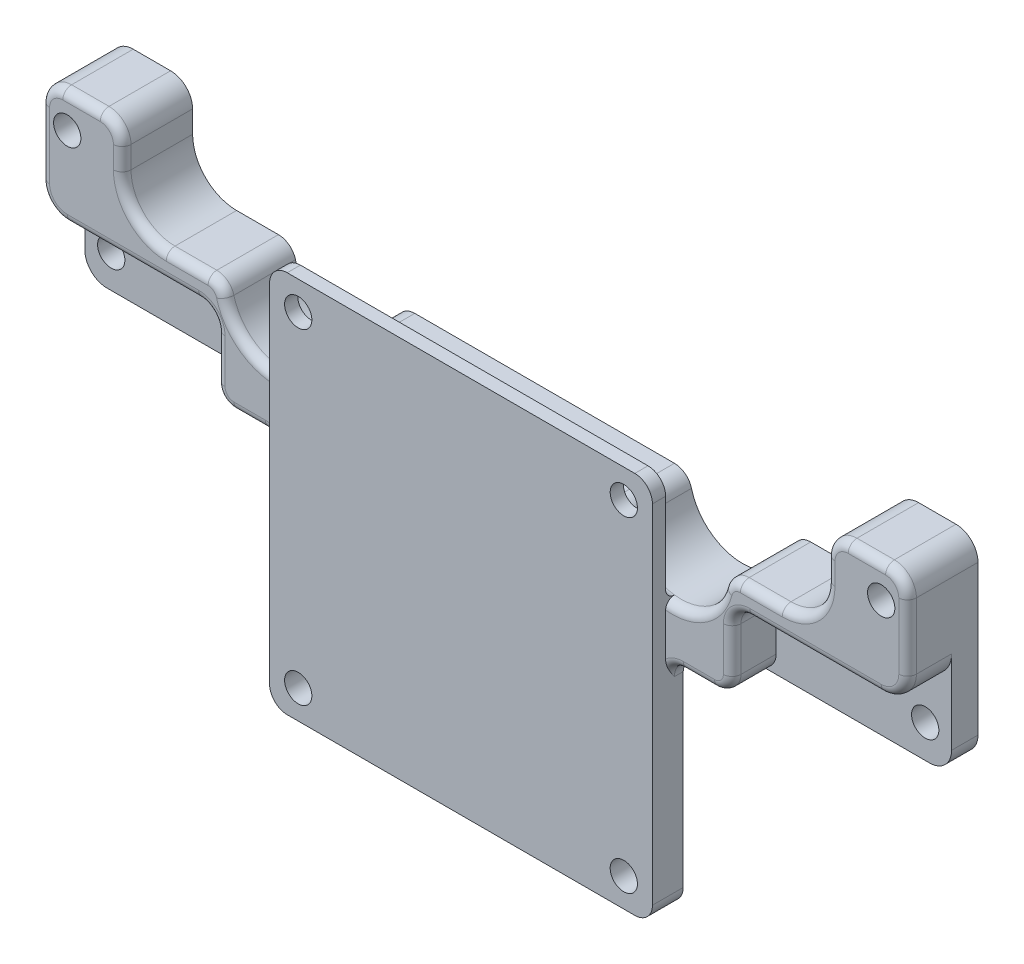
from build123d import *

# Parameters (mm, degrees)
SKETCH2_R               = 2
BOSS_EXTRUDE1_DEPTH     = 8
FILLET1_R               = 2.5
FILLET2_R               = 2.5
FILLET3_R               = 5
SKETCH4_R               = 6
CUT_EXTRUDE1_DEPTH      = 3
FILLET4_R               = 2
SKETCH6_W               = 43.5
SKETCH6_H               = 43.5
BOSS_EXTRUDE2_DEPTH     = 1.5
CUT_EXTRUDE2_DEPTH      = 62.356539994
SKETCH7_R               = 1.55
CUT_EXTRUDE3_DEPTH      = 62.885983874
SKETCH9_W               = 43.5
SKETCH9_H               = 25.25
SKETCH9_R               = 1.55
BOSS_EXTRUDE3_DEPTH     = 2
FILLET5_R               = 2
SKETCH11_W              = 24
SKETCH11_H              = 12.133982922
CUT_EXTRUDE4_DEPTH      = 5
FILLET6_R               = 2
FILLET7_R               = 3
FILLET8_R               = 1
FILLET9_R               = 2
FILLET11_R              = 1
CUT_EXTRUDE5_DEPTH      = 62.885983932
CUT_EXTRUDE5_DEPTH_BACK = 62.885983932
BOSS_EXTRUDE4_START     = -8
SKETCH14_R              = 2
SKETCH14_R_2            = 1.55
BOSS_EXTRUDE4_DEPTH     = 8
SKETCH15_W              = 25.857004487
SKETCH15_H              = 16.199569076
SKETCH15_W_2            = 17.341846383
SKETCH15_H_2            = 17.1341596
CUT_EXTRUDE6_DEPTH      = 62.496951155


with BuildPart() as part:
    # Sketch2 → Boss-Extrude1 (new body)
    with BuildSketch(Plane.XY):
        Polygon((-49.25, -11), (49.25, -11), (49.25, 11), (40, 11), (40, 1), (-40, 1), (-40, 11), (-49.25, 11), align=None)
        with Locations((-46.25, 7.25)):
            Circle(SKETCH2_R, mode=Mode.SUBTRACT)
        with Locations((-46.25, -7.25)):
            Circle(SKETCH2_R, mode=Mode.SUBTRACT)
        with Locations(Location((46.25, 7.25, 0), (0, 0, 180))):
            Circle(SKETCH2_R, mode=Mode.SUBTRACT)
        with Locations(Location((46.25, -7.25, 0), (0, 0, 180))):
            Circle(SKETCH2_R, mode=Mode.SUBTRACT)
    extrude(amount=BOSS_EXTRUDE1_DEPTH)

    # Fillet1
    fillet1_edges = [part.edges().sort_by_distance(p)[0] for p in [
        (-49.25, -11, 4),
        (-49.25, 11, 4),
        (49.25, 11, 4),
        (49.25, -11, 4),
    ]]
    fillet(fillet1_edges, radius=FILLET1_R)

    # Fillet2
    fillet2_edges = [part.edges().sort_by_distance(p)[0] for p in [
        (-40, 11, 4),
        (40, 11, 4),
    ]]
    fillet(fillet2_edges, radius=FILLET2_R)

    # Fillet3
    fillet3_edges = [part.edges().sort_by_distance(p)[0] for p in [
        (-40, 1, 4),
        (40, 1, 4),
    ]]
    fillet(fillet3_edges, radius=FILLET3_R)

    # Sketch4 → Cut-Extrude1 (cut)
    with BuildSketch(Plane.XY.offset(8)):
        with Locations((-22.5, 1)):
            Circle(SKETCH4_R)
        with Locations((22.5, 1)):
            Circle(SKETCH4_R)
    extrude(amount=-CUT_EXTRUDE1_DEPTH, mode=Mode.SUBTRACT)

    # Fillet4
    fillet4_edges = [part.edges().sort_by_distance(p)[0] for p in [
        (28.5, 1, 6.5),
        (-28.5, 1, 6.5),
        (-16.5, 1, 6.5),
        (16.5, 1, 6.5),
    ]]
    fillet(fillet4_edges, radius=FILLET4_R)

    # Sketch6 → Boss-Extrude2 (add)
    with BuildSketch(Plane.XY.offset(8)):
        with Locations((0, -14.5)):
            Rectangle(SKETCH6_W, SKETCH6_H)
    extrude(amount=BOSS_EXTRUDE2_DEPTH)

    # Sketch8 → Cut-Extrude2 (cut, through all)
    with BuildSketch(Plane.XY.offset(5)):
        with BuildLine():
            Line((30.245966692, 1), (14.754033308, 1))
            ThreePointArc((14.754033308, 1), (15.978778179, 0.58113883), (16.690524981, -0.5))
            ThreePointArc((16.690524981, -0.5), (22.5, -5), (28.309475019, -0.5))
            ThreePointArc((28.309475019, -0.5), (29.021221821, 0.58113883), (30.245966692, 1))
        make_face()
        with BuildLine():
            Line((-14.754033308, 1), (-30.245966692, 1))
            ThreePointArc((-30.245966692, 1), (-29.021221821, 0.58113883), (-28.309475019, -0.5))
            ThreePointArc((-28.309475019, -0.5), (-22.5, -5), (-16.690524981, -0.5))
            ThreePointArc((-16.690524981, -0.5), (-15.978778179, 0.58113883), (-14.754033308, 1))
        make_face()
    extrude(amount=-CUT_EXTRUDE2_DEPTH, mode=Mode.SUBTRACT)

    # Sketch7 → Cut-Extrude3 (cut, through all)
    with BuildSketch(Plane.XY.offset(9.5)):
        with Locations((-18.5, 4)):
            Circle(SKETCH7_R)
        with Locations((18.5, 4)):
            Circle(SKETCH7_R)
        with Locations((18.5, -33)):
            Circle(SKETCH7_R)
        with Locations((-18.5, -33)):
            Circle(SKETCH7_R)
    extrude(amount=-CUT_EXTRUDE3_DEPTH, mode=Mode.SUBTRACT)

    # Sketch9 → Boss-Extrude3 (add)
    with BuildSketch(Plane(origin=(0, 0, 8), x_dir=(-1, 0, 0), z_dir=(0, 0, -1))):
        with Locations((0, -23.625)):
            Rectangle(SKETCH9_W, SKETCH9_H)
        with Locations(Location((18.5, -33, 0), (0, 0, 180))):
            Circle(SKETCH9_R, mode=Mode.SUBTRACT)
        with Locations(Location((-18.5, -33, 0), (0, 0, 180))):
            Circle(SKETCH9_R, mode=Mode.SUBTRACT)
    extrude(amount=BOSS_EXTRUDE3_DEPTH)

    # Fillet5
    fillet5_edges = [part.edges().sort_by_distance(p)[0] for p in [
        (0, -11, 6),
        (-21.75, -11, 7),
        (21.75, -11, 7),
    ]]
    fillet(fillet5_edges, radius=FILLET5_R)

    # Sketch11 → Cut-Extrude4 (cut)
    with BuildSketch(Plane.XY.offset(8)):
        with Locations((41.314196824, -8.07245273)):
            Rectangle(SKETCH11_W, SKETCH11_H)
    extrude(amount=-CUT_EXTRUDE4_DEPTH, mode=Mode.SUBTRACT)

    # Fillet6
    fillet6_edges = [part.edges().sort_by_distance(p)[0] for p in [
        (29.314196824, -11, 5.5),
        (29.314196824, -2.005461269, 5.5),
    ]]
    fillet(fillet6_edges, radius=FILLET6_R)

    # Fillet7
    fillet7_edges = [part.edges().sort_by_distance(p)[0] for p in [
        (49.25, -2.005461269, 5.5),
    ]]
    fillet(fillet7_edges, radius=FILLET7_R)

    # Fillet8
    fillet8_edges = [part.edges().sort_by_distance(p)[0] for p in [
        (29.021221821, 0.58113883, 8),
        (25.869976488, -3.964197666, 8),
        (25.532098412, -11, 8),
        (22.335786438, -11.585786438, 8),
        (29.314196824, -6.502730634, 8),
        (28.728410386, -10.414213562, 8),
        (29.899983262, -2.591247706, 8),
        (49.25, 4.747269366, 8),
        (38.782098412, -2.005461269, 8),
        (48.371320344, -1.126781612, 8),
        (44.625, 11, 8),
        (48.517766953, 10.267766953, 8),
        (40.732233047, 10.267766953, 8),
        (32.622983346, 1, 8),
        (40, 7.25, 8),
        (38.535533906, 2.464466094, 8),
    ]]
    fillet(fillet8_edges, radius=FILLET8_R - 0.0001)  # a hair under: the kernel refuses the full size

    # Fillet9
    fillet9_edges = [part.edges().sort_by_distance(p)[0] for p in [
        (21.75, -36.25, 7.75),
        (21.75, 7.25, 8.75),
    ]]
    fillet(fillet9_edges, radius=FILLET9_R)

    # Fillet11
    fillet11_edges = [part.edges().sort_by_distance(p)[0] for p in [
        (18.5359304, -3.50401512, 8),
        (15.978778179, 0.58113883, 8),
        (-18.5359304, -3.50401512, 8),
        (-15.978778179, 0.58113883, 8),
        (0, 1, 8),
    ]]
    fillet(fillet11_edges, radius=FILLET11_R - 0.0001)  # a hair under: the kernel refuses the full size

    # Sketch13 → Cut-Extrude5 (cut, two sides: drawn at the far end of the back side and taken through both)
    with BuildSketch(Plane.XY.offset(9.5).offset(-CUT_EXTRUDE5_DEPTH_BACK)):
        Polygon((0, 0), (0, 36.555345385), (-73.677801183, 31.211207192), (-63.679091017, -36.883456875), (-4.893570898, -56.018919436), (-1.96291447, -52.915871453), (0, -39.469330194), align=None)
    extrude(amount=CUT_EXTRUDE5_DEPTH + CUT_EXTRUDE5_DEPTH_BACK, mode=Mode.SUBTRACT)

    # Mirror1: part across plane


with BuildPart() as part_1:
    add(part.part)
    add(part.part.mirror(Plane(origin=(0, 0, 0), x_dir=(0, 0, 1), z_dir=(1, 0, 0))))

    # Sketch14 → Boss-Extrude4 (add)
    # profile 1 of 4: a face of its own
    with BuildSketch(Plane.XY.offset(8).offset(BOSS_EXTRUDE4_START)):
        with Locations((46.25, 7.25)):
            Circle(SKETCH14_R)
        with Locations((46.25, 7.25)):
            Circle(SKETCH14_R_2, mode=Mode.SUBTRACT)
    # profile 2 of 4: a face of its own
    with BuildSketch(Plane.XY.offset(8).offset(BOSS_EXTRUDE4_START)):
        with Locations((46.25, -7.25)):
            Circle(SKETCH14_R)
        with Locations((46.25, -7.25)):
            Circle(SKETCH14_R_2, mode=Mode.SUBTRACT)
    # profile 3 of 4: a face of its own
    with BuildSketch(Plane.XY.offset(8).offset(BOSS_EXTRUDE4_START)):
        with Locations((-46.25, -7.25)):
            Circle(SKETCH14_R)
        with Locations((-46.25, -7.25)):
            Circle(SKETCH14_R_2, mode=Mode.SUBTRACT)
    # profile 4 of 4: a face of its own
    with BuildSketch(Plane.XY.offset(8).offset(BOSS_EXTRUDE4_START)):
        with Locations((-46.25, 7.25)):
            Circle(SKETCH14_R)
        with Locations((-46.25, 7.25)):
            Circle(SKETCH14_R_2, mode=Mode.SUBTRACT)
    extrude(amount=BOSS_EXTRUDE4_DEPTH)

    # Sketch15 → Cut-Extrude6 (cut, through all)
    with BuildSketch(Plane.XY.offset(3)):
        with Locations((-48.546785533, -10.963505736)):
            Rectangle(SKETCH15_W, SKETCH15_H)
        with Locations((45.846857353, -12.98845187)):
            Rectangle(SKETCH15_W_2, SKETCH15_H_2)
    extrude(amount=CUT_EXTRUDE6_DEPTH, mode=Mode.SUBTRACT)


solid = part_1.part
